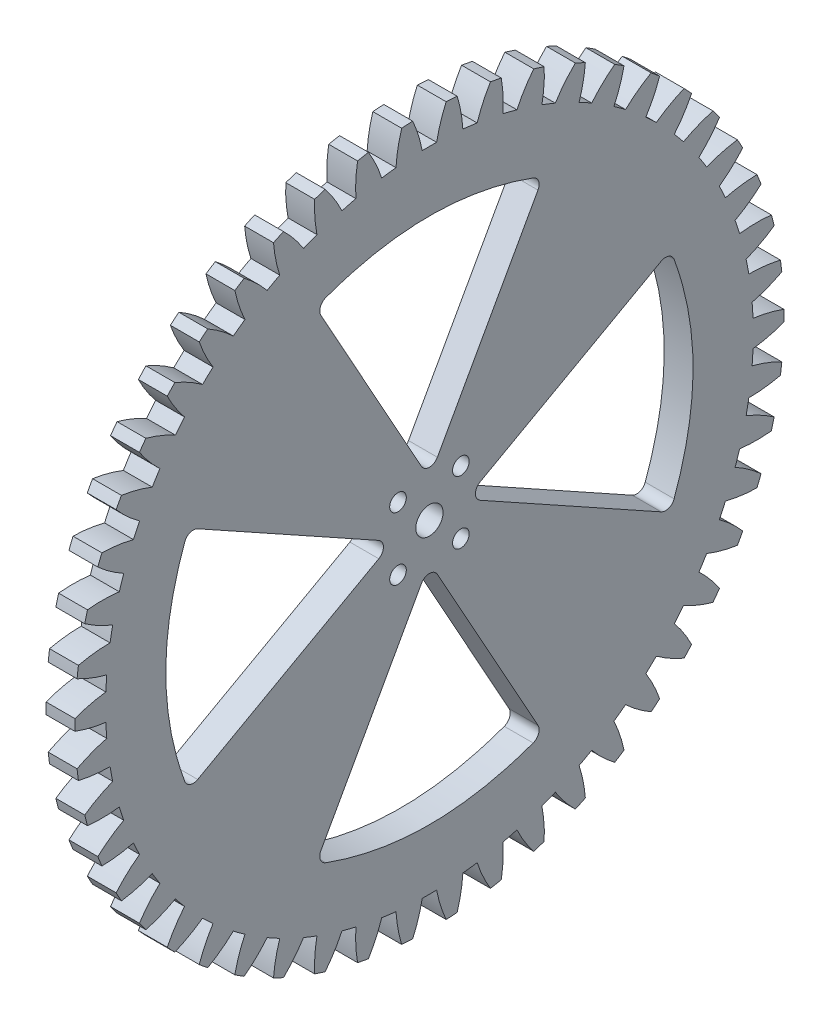
from build123d import *

# Parameters (mm, degrees)
BASPROSKE_W                        = 6.35
BASPROSKE_H                        = 78
TOOTHCUT_DEPTH                     = 111.491277936
TEETHCUTS_COUNT                    = 50
TEETHCUTS_ANGLE                    = 352.8
BORSKE_R                           = 3
BORE_DEPTH                         = 50.0000508
ENL_V_MAT_EXTRU_1_REACH            = 112.43
ESQUISSE1_R                        = 1.83
R_P_TITION_CIRCULAIRE1_COUNT       = 4
ENL_V_MAT_EXTRU_2_REACH            = 112.43
CONG_1_R                           = 2
R_P_TITION_CIRCULAIRE2_COUNT       = 4
CONG_1_OF_R_P_TITION_CIRCULAIRE2_R = 2


with BuildPart() as part:
    # BasProSke → Base-Revolve (revolve)
    with BuildSketch(Plane(origin=(0, 0, 0), x_dir=(1, 0, 0), z_dir=(0, 1, 0))):
        with Locations((3.175, 39)):
            Rectangle(BASPROSKE_W, BASPROSKE_H)
    revolve(axis=Axis((-10, 0, 0), (1, 0, 0)))

    # TooCutSke → ToothCut (cut, through all)
    with BuildSketch(Plane(origin=(0, 0, 0), x_dir=(0, 0, -1), z_dir=(1, 0, 0))):
        with BuildLine():
            ThreePointArc((1.584443832, 71.231380295), (0, 71.249), (-1.584443832, 71.231380295))
            ThreePointArc((-1.584443832, 71.231380295), (-2.443481522, 74.646676615), (-3.696827947, 77.937773309))
            ThreePointArc((-3.696827947, 77.937773309), (0, 78.0254), (3.696827947, 77.937773309))
            ThreePointArc((3.696827947, 77.937773309), (2.443481522, 74.646676615), (1.584443832, 71.231380295))
        make_face()
    toothcut = extrude(amount=TOOTHCUT_DEPTH, mode=Mode.SUBTRACT)

    # TeethCuts: ToothCut ×50 about axis
    teethcuts_axis = Axis((-10, 0, 0), (1, 0, 0))
    for i in range(1, TEETHCUTS_COUNT):
        add(toothcut.rotate(teethcuts_axis, i * TEETHCUTS_ANGLE / (TEETHCUTS_COUNT - 1)), mode=Mode.SUBTRACT)

    # BorSke → Bore (cut, symmetric)
    with BuildSketch(Plane(origin=(0, 0, 0), x_dir=(0, 0, -1), z_dir=(1, 0, 0))):
        Circle(BORSKE_R)
    extrude(amount=BORE_DEPTH, both=True, mode=Mode.SUBTRACT)

    # Esquisse1 → Enlèv. mat.-Extru.1 (cut, up to next)
    with BuildSketch(Plane.ZY, mode=Mode.PRIVATE) as enl_v_mat_extru_1_sk1:
        with Locations((6.914797213, 6.914797213)):
            Circle(ESQUISSE1_R)
    enl_v_mat_extru_1_tool1 = extrude(enl_v_mat_extru_1_sk1.sketch, amount=-ENL_V_MAT_EXTRU_1_REACH, mode=Mode.PRIVATE) & part.part
    enl_v_mat_extru_1 = enl_v_mat_extru_1_tool1.solids().sort_by_distance((0, 6.914797, 6.914797))[0]
    add(enl_v_mat_extru_1, mode=Mode.SUBTRACT)

    # Répétition circulaire1: Enlèv. mat.-Extru.1 ×4 about axis
    r_p_tition_circulaire1_axis = Axis((0, 0, 0), (-1, 0, 0))
    for i in range(1, R_P_TITION_CIRCULAIRE1_COUNT):
        add(enl_v_mat_extru_1.rotate(r_p_tition_circulaire1_axis, i * 360 / R_P_TITION_CIRCULAIRE1_COUNT), mode=Mode.SUBTRACT)

    # Esquisse2 → Enlèv. mat.-Extru.2 (cut, up to next)
    with BuildSketch(Plane(origin=(6.35, 0, 0), x_dir=(0, 0, -1), z_dir=(1, 0, 0)), mode=Mode.PRIVATE) as enl_v_mat_extru_2_sk1:
        with BuildLine():
            Line((-53, 25), (-8, 0))
            Line((-8, 0), (-53, -25))
            add(Edge.make_bspline(
                [(-53, 25), (-63, 0), (-53, -25)],
                knots=[0, 0, 0, 1, 1, 1], degree=2))
        make_face()
    enl_v_mat_extru_2_tool1 = extrude(enl_v_mat_extru_2_sk1.sketch, amount=-ENL_V_MAT_EXTRU_2_REACH, mode=Mode.PRIVATE) & part.part
    enl_v_mat_extru_2 = enl_v_mat_extru_2_tool1.solids().sort_by_distance((6.35, 0, 40.193548))[0]
    add(enl_v_mat_extru_2, mode=Mode.SUBTRACT)

    # Congé1
    cong_1_edges = [part.edges().sort_by_distance(p)[0] for p in [
        (3.175, -25, 53),
        (3.175, 25, 53),
        (3.175, 0, 8),
    ]]
    fillet(cong_1_edges, radius=CONG_1_R)

    # Répétition circulaire2: Enlèv. mat.-Extru.2 ×4 about axis
    r_p_tition_circulaire2_axis = Axis((6.35, 0, 0), (1, 0, 0))
    for i in range(1, R_P_TITION_CIRCULAIRE2_COUNT):
        add(enl_v_mat_extru_2.rotate(r_p_tition_circulaire2_axis, i * 360 / R_P_TITION_CIRCULAIRE2_COUNT), mode=Mode.SUBTRACT)

    # Congé1 of Répétition circulaire2
    cong_1_of_r_p_tition_circulaire2_edges = [part.edges().sort_by_distance(p)[0] for p in [
        (3.175, -53, -25),
        (3.175, -53, 25),
        (3.175, -8, 0),
        (3.175, 25, -53),
        (3.175, -25, -53),
        (3.175, 0, -8),
        (3.175, 53, 25),
        (3.175, 53, -25),
        (3.175, 8, 0),
    ]]
    fillet(cong_1_of_r_p_tition_circulaire2_edges, radius=CONG_1_OF_R_P_TITION_CIRCULAIRE2_R)


solid = part.part
